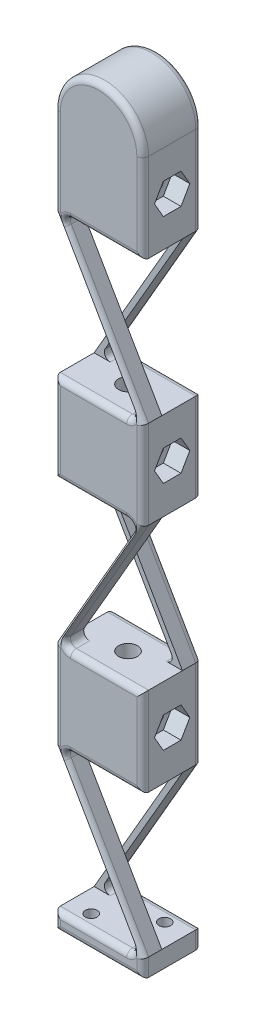
from build123d import *

# Parameters (mm, degrees)
SKETCH1_W                   = 15
SKETCH1_H                   = 15
BOSS_EXTRUDE1_DEPTH         = 5
BOSS_EXTRUDE2_START         = 5
BOSS_EXTRUDE2_DEPTH         = 3.25
BOSS_EXTRUDE3_START         = -5
BOSS_EXTRUDE3_DEPTH         = 3.25
SKETCH1_5_W                 = 15
SKETCH1_5_H                 = 15
BOSS_EXTRUDE4_DEPTH         = 5
BOSS_EXTRUDE5_DEPTH         = 10
SKETCH36_W                  = 15
SKETCH36_H                  = 10
CUT_EXTRUDE1_DEPTH          = 129.56251734
FILLET1_R                   = 1
F_2_0_MM_DOWEL_HOLES1_D     = 2
F_2_0_MM_DOWEL_HOLES1_DEPTH = 3
SKETCH50_R                  = 1.6
CUT_EXTRUDE2_DEPTH          = 15
SKETCH51_R                  = 1.6
CUT_EXTRUDE3_DEPTH          = 15
CUT_SWEEP1_PROFILE_R        = 1.6
CUT_SWEEP3_PROFILE_R        = 1.6
CUT_EXTRUDE4_DEPTH          = 3
LPATTERN1_COUNT             = 3
LPATTERN1_PITCH             = 39.25
LPATTERN2_OUTLINE_R         = 1.6
LPATTERN2_ANGLE             = 90
LPATTERN2_START             = 3.1999999
LPATTERN2_2_OUTLINE_R       = 1.6
LPATTERN2_2_DEPTH           = 1.8000001
FILLET2_R                   = 1


with BuildPart() as part:
    # Sketch1 → Boss-Extrude1 (new, symmetric)
    with BuildSketch(Plane.XY):
        with Locations((0, -19.624355653)):
            Rectangle(SKETCH1_W, SKETCH1_H)
    boss_extrude1 = extrude(amount=BOSS_EXTRUDE1_DEPTH, both=True)

    # Sketch1<3> → Boss-Extrude2 (add)
    with BuildSketch(Plane.XY.offset(BOSS_EXTRUDE2_START)):
        Polygon((-6.5, -12.124355653), (0, -0.866025404), (-0.5, 0), (-7.5, -12.124355653), align=None)
        Polygon((0.5, 0), (7.5, 12.124355653), (6.5, 12.124355653), (0, 0.866025404), align=None)
        Polygon((0, -0.866025404), (0.5, 0), (0, 0.866025404), (-0.5, 0), align=None)
    boss_extrude2 = extrude(amount=-BOSS_EXTRUDE2_DEPTH)

    # Sketch1<4> → Boss-Extrude3 (add)
    with BuildSketch(Plane.XY.offset(BOSS_EXTRUDE3_START)):
        Polygon((0, 0.866025404), (-6.5, 12.124355653), (-7.5, 12.124355653), (-0.5, 0), align=None)
        Polygon((7.5, -12.124355653), (0.5, 0), (0, -0.866025404), (6.5, -12.124355653), align=None)
        Polygon((0, -0.866025404), (0.5, 0), (0, 0.866025404), (-0.5, 0), align=None)
    boss_extrude3 = extrude(amount=BOSS_EXTRUDE3_DEPTH)

    # Sketch1<5> → Boss-Extrude4 (add, symmetric)
    with BuildSketch(Plane.XY):
        with Locations((0, 19.624355653)):
            Rectangle(SKETCH1_5_W, SKETCH1_5_H)
    boss_extrude4 = extrude(amount=BOSS_EXTRUDE4_DEPTH, both=True)

    # Mirror2: Boss-Extrude2, Boss-Extrude3 across plane
    add(boss_extrude2.mirror(Plane(origin=(0, 19.624355653, 0), x_dir=(0, 0, 1), z_dir=(0, -1, 0))))
    add(boss_extrude3.mirror(Plane(origin=(0, 19.624355653, 0), x_dir=(0, 0, 1), z_dir=(0, -1, 0))))

    # Mirror3: Boss-Extrude1 across plane
    add(boss_extrude1.mirror(Plane(origin=(0, 19.624355653, 0), x_dir=(0, 0, 1), z_dir=(0, -1, 0))))

    # Mirror4: Boss-Extrude2 across plane
    add(boss_extrude2.mirror(Plane.ZX.offset(-19.624355653)))

    # Mirror5: Boss-Extrude3 across plane
    add(boss_extrude3.mirror(Plane.ZX.offset(-19.624355653)))

    # Mirror6: Boss-Extrude4 across plane
    add(boss_extrude4.mirror(Plane.ZX.offset(-19.624355653)))

    # Sketch29 → Boss-Extrude5 (add)
    with BuildSketch(Plane.XY.offset(5)):
        with BuildLine():
            ThreePointArc((-7.5, 66.373066959), (0, 73.873066959), (7.5, 66.373066959))
            Line((7.5, 66.373066959), (-7.5, 66.373066959))
        make_face()
    extrude(amount=-BOSS_EXTRUDE5_DEPTH)

    # Sketch36 → Cut-Extrude1 (cut, through all)
    with BuildSketch(Plane(origin=(0, -54.373066959, 0), x_dir=(1, 0, 0), z_dir=(0, 1, 0))):
        Rectangle(SKETCH36_W, SKETCH36_H)
    extrude(amount=-CUT_EXTRUDE1_DEPTH, mode=Mode.SUBTRACT)

    # Fillet1
    fillet1_edges = [part.edges().sort_by_distance(p)[0] for p in [
        (-6.5, -27.124355653, 3.375),
        (6.5, -51.373066959, 3.375),
        (6.5, -27.124355653, -3.375),
        (-6.5, -51.373066959, -3.375),
        (6.5, 12.124355653, 3.375),
        (-6.5, -12.124355653, 3.375),
        (6.5, -12.124355653, -3.375),
        (-6.5, 12.124355653, -3.375),
        (-6.5, 51.373066959, 3.375),
        (6.5, 27.124355653, 3.375),
        (6.5, 51.373066959, -3.375),
        (-6.5, 27.124355653, -3.375),
    ]]
    fillet(fillet1_edges, radius=FILLET1_R)

    # Ø2.0 mm Dowel Holes1
    with Locations(Plane(origin=(0, -51.373066959, 0), x_dir=(1, 0, 0), z_dir=(0, 1, 0))):
        with Locations((3.75, 2.5), (-3.75, -2.5)):
            Hole(F_2_0_MM_DOWEL_HOLES1_D / 2, depth=F_2_0_MM_DOWEL_HOLES1_DEPTH)

    # Sketch50 → Cut-Extrude2 (cut)
    with BuildSketch(Plane(origin=(0, 27.124355653, 0), x_dir=(1, 0, 0), z_dir=(0, 1, 0))):
        with Locations(Location((0, 0, 0), (0, 0, 180))):
            Circle(SKETCH50_R)
    extrude(amount=-CUT_EXTRUDE2_DEPTH, mode=Mode.SUBTRACT)

    # Sketch51 → Cut-Extrude3 (cut)
    with BuildSketch(Plane(origin=(0, -12.124355653, 0), x_dir=(1, 0, 0), z_dir=(0, 1, 0))):
        with Locations(Location((0, 0, 0), (0, 0, 180))):
            Circle(SKETCH51_R)
    extrude(amount=-CUT_EXTRUDE3_DEPTH, mode=Mode.SUBTRACT)

    # Cut-Sweep1: sweep along a path in Sketch10
    with BuildLine(Plane.XY) as cut_sweep1_path:
        Line((0, 12.124355653), (0, 16.424355653))
        ThreePointArc((0, 16.424355653), (0.9372583, 18.687097353), (3.2, 19.624355653))
        Line((3.2, 19.624355653), (7.5, 19.624355653))
    # Cut-Sweep1 profile (on start of the path) → Cut-Sweep1 (sweep, cut)
    with BuildSketch(Plane(origin=(0, 12.124355653, 0), x_dir=(1, 0, 0), z_dir=(0, 1, 0))):
        Circle(CUT_SWEEP1_PROFILE_R)
    sweep(path=cut_sweep1_path.line, mode=Mode.SUBTRACT)

    # Cut-Sweep3: sweep along a path in Sketch67
    with BuildLine(Plane.XY) as cut_sweep3_path:
        Line((0, 51.373066959), (0, 55.673066959))
        ThreePointArc((0, 55.673066959), (0.9372583, 57.935808659), (3.2, 58.873066959))
        Line((3.2, 58.873066959), (7.5, 58.873066959))
    # Cut-Sweep3 profile (on start of the path) → Cut-Sweep3 (sweep, cut)
    with BuildSketch(Plane(origin=(0, 51.373066959, 0), x_dir=(1, 0, 0), z_dir=(0, 1, 0))):
        Circle(CUT_SWEEP3_PROFILE_R)
    sweep(path=cut_sweep3_path.line, mode=Mode.SUBTRACT)

    # Sketch79 → Cut-Extrude4 (cut)
    with BuildSketch(Plane(origin=(7.5, 0, 0), x_dir=(0, 0, -1), z_dir=(1, 0, 0))):
        Polygon((-1.5, 61.47114317), (-3, 58.873066959), (-1.5, 56.274990748), (1.5, 56.274990748), (3, 58.873066959), (1.5, 61.47114317), align=None)
    cut_extrude4 = extrude(amount=-CUT_EXTRUDE4_DEPTH, mode=Mode.SUBTRACT)

    # LPattern1: Cut-Extrude4 ×3
    with Locations(*[(0, -i * LPATTERN1_PITCH, 0) for i in range(1, LPATTERN1_COUNT)]):
        add(cut_extrude4, mode=Mode.SUBTRACT)

    # LPattern2: read off the stored shape, not the designer's step
    # LPattern2 outline → LPattern2 (revolve, cut)
    with BuildSketch(Plane(origin=(3.2, -22.826933041, 0), x_dir=(0, 1, 0), z_dir=(1, 0, 0))):
        with Locations((3.2, 0)):
            Circle(LPATTERN2_OUTLINE_R)
    revolve(axis=Axis((3.2, -22.826933041, 0), (0, 0, 1)), revolution_arc=LPATTERN2_ANGLE, mode=Mode.SUBTRACT)

    # LPattern2 2 outline → LPattern2 2 (cut)
    with BuildSketch(Plane.YZ.offset(LPATTERN2_START)):
        with Locations((-19.626933041, 0)):
            Circle(LPATTERN2_2_OUTLINE_R)
    extrude(amount=LPATTERN2_2_DEPTH, mode=Mode.SUBTRACT)

    # Fillet2
    # the kernel refuses this fillet: 1 mm, written as the material it takes off along each edge
    with BuildSketch(Plane(origin=(10, -27.124355653, 5), x_dir=(0, 0, -1), z_dir=(-1, 0, 0)), Plane(origin=(4.767949192, -51.373066959, 5), x_dir=(0, -1, 0), z_dir=(-1, 0, 0)), Plane(origin=(-10, -12.124355653, -5), x_dir=(0, -1, 0), z_dir=(1, 0, 0)), Plane(origin=(-4.767949192, 27.124355653, -5), x_dir=(0, -1, 0), z_dir=(1, 0, 0)), Plane(origin=(10, 12.124355653, -5), x_dir=(0, 1, 0), z_dir=(-1, 0, 0)), Plane(origin=(-4.767949192, 51.373066959, 5), x_dir=(0, 1, 0), z_dir=(1, 0, 0))) as fillet2_piece_1:
        with BuildLine():
            CenterArc((FILLET2_R, -FILLET2_R), FILLET2_R, 90, 90)
            Line((0, -FILLET2_R), (0, 0))
            Line((0, 0), (FILLET2_R, 0))
        make_face()
    extrude(amount=14.767949192, mode=Mode.SUBTRACT)
    with BuildSketch(Plane(origin=(8.75, -24.959292144, -5), x_dir=(-0.866025403784435, 0.5000000000000062, 0), z_dir=(-0.5000000000000062, -0.8660254037844352, 0)), Plane(origin=(-8.75, -24.959292144, 5), x_dir=(0.8660254037844369, 0.500000000000003, 0), z_dir=(0.5000000000000031, -0.8660254037844369, 0)), Plane(origin=(-5.633974596, -10.624355653, 5), x_dir=(-0.8660254037844368, 0.5000000000000032, 0), z_dir=(0.5000000000000032, 0.8660254037844368, 0)), Plane(origin=(-8.75, 53.538130468, 5), x_dir=(0.8660254037844345, 0.5000000000000073, 0), z_dir=(0.5000000000000073, -0.8660254037844345, 0)), Plane(origin=(5.633974596, -10.624355653, -5), x_dir=(0.8660254037844363, 0.5000000000000042, 0), z_dir=(-0.5000000000000042, 0.8660254037844363, 0)), Plane(origin=(8.75, 53.538130468, -5), x_dir=(-0.8660254037844376, 0.500000000000002, 0), z_dir=(-0.500000000000002, -0.8660254037844376, 0))) as fillet2_piece_2:
        with BuildLine():
            CenterArc((FILLET2_R, -FILLET2_R), FILLET2_R, 90, 90)
            Line((0, -FILLET2_R), (0, 0))
            Line((0, 0), (FILLET2_R, 0))
        make_face()
    extrude(amount=28.767949192, mode=Mode.SUBTRACT)
    with BuildSketch(Plane(origin=(5.633974596, -28.624355653, -5), x_dir=(0.8660254037844349, -0.5000000000000063, 0), z_dir=(-0.5000000000000063, -0.866025403784435, 0)), Plane(origin=(-5.633974596, -28.624355653, 5), x_dir=(-0.866025403784438, -0.5000000000000011, 0), z_dir=(0.5000000000000011, -0.866025403784438, 0)), Plane(origin=(-8.75, -14.289419162, 5), x_dir=(0.8660254037844357, -0.5000000000000052, 0), z_dir=(0.5000000000000052, 0.8660254037844357, 0)), Plane(origin=(-5.633974596, 49.873066959, 5), x_dir=(-0.8660254037844357, -0.5000000000000053, 0), z_dir=(0.5000000000000053, -0.8660254037844356, 0)), Plane(origin=(8.75, -14.289419162, -5), x_dir=(-0.8660254037844363, -0.5000000000000041, 0), z_dir=(-0.5000000000000041, 0.8660254037844364, 0)), Plane(origin=(5.633974596, 49.873066959, -5), x_dir=(0.8660254037844375, -0.5000000000000021, 0), z_dir=(-0.5000000000000021, -0.8660254037844375, 0))) as fillet2_piece_3:
        with BuildLine():
            CenterArc((FILLET2_R, FILLET2_R), FILLET2_R, 180, 90)
            Line((0, FILLET2_R), (0, 0))
            Line((0, 0), (FILLET2_R, 0))
        make_face()
    extrude(amount=28.767949192, mode=Mode.SUBTRACT)
    with BuildSketch(Plane(origin=(10, -51.373066959, -5), x_dir=(0, -1, 0), z_dir=(-1, 0, 0)), Plane(origin=(4.767949192, -27.124355653, -5), x_dir=(0, 0, 1), z_dir=(-1, 0, 0)), Plane(origin=(4.767949192, 12.124355653, 5), x_dir=(0, 1, 0), z_dir=(-1, 0, 0)), Plane(origin=(-10, 51.373066959, -5), x_dir=(0, 1, 0), z_dir=(1, 0, 0)), Plane(origin=(-10, 27.124355653, 5), x_dir=(0, -1, 0), z_dir=(1, 0, 0)), Plane(origin=(-4.767949192, -12.124355653, 5), x_dir=(0, -1, 0), z_dir=(1, 0, 0))) as fillet2_piece_4:
        with BuildLine():
            CenterArc((FILLET2_R, FILLET2_R), FILLET2_R, 180, 90)
            Line((0, FILLET2_R), (0, 0))
            Line((0, 0), (FILLET2_R, 0))
        make_face()
    extrude(amount=14.767949192, mode=Mode.SUBTRACT)
    with BuildSketch(Plane(origin=(0, 66.373066959, -5), x_dir=(-1, 0, 0), z_dir=(0, -1, 0))) as fillet2_piece_5:
        with BuildLine():
            CenterArc((7.5 - FILLET2_R, -FILLET2_R), FILLET2_R, 0, 90)
            Line((7.5, -FILLET2_R), (7.5, 0))
            Line((7.5, 0), (7.5 - FILLET2_R, 0))
        make_face()
    revolve(axis=Axis((0, 66.373066959, -5), (0, 0, -1)), revolution_arc=180, mode=Mode.SUBTRACT)
    with BuildSketch(Plane(origin=(0, 66.373066959, 5), x_dir=(-1, 0, 0), z_dir=(0, -1, 0))) as fillet2_piece_6:
        with BuildLine():
            CenterArc((7.5 - FILLET2_R, FILLET2_R), FILLET2_R, 270, 90)
            Line((7.5, FILLET2_R), (7.5, 0))
            Line((7.5, 0), (7.5 - FILLET2_R, 0))
        make_face()
    revolve(axis=Axis((0, 66.373066959, 5), (0, 0, -1)), revolution_arc=180, mode=Mode.SUBTRACT)
    with BuildSketch(Plane(origin=(-7.5, -48.873066959, -5), x_dir=(1, 0, 0), z_dir=(0, -1, 0)), Plane(origin=(7.5, -56.873066959, -5), x_dir=(-1, 0, 0), z_dir=(0, 1, 0))) as fillet2_piece_7:
        with BuildLine():
            CenterArc((FILLET2_R, FILLET2_R), FILLET2_R, 180, 90)
            Line((0, FILLET2_R), (0, 0))
            Line((0, 0), (FILLET2_R, 0))
        make_face()
    extrude(amount=8, mode=Mode.SUBTRACT)
    with BuildSketch(Plane(origin=(-7.5, -48.873066959, 5), x_dir=(1, 0, 0), z_dir=(0, -1, 0)), Plane(origin=(7.5, -56.873066959, 5), x_dir=(-1, 0, 0), z_dir=(0, 1, 0))) as fillet2_piece_8:
        with BuildLine():
            CenterArc((FILLET2_R, -FILLET2_R), FILLET2_R, 90, 90)
            Line((0, -FILLET2_R), (0, 0))
            Line((0, 0), (FILLET2_R, 0))
        make_face()
    extrude(amount=8, mode=Mode.SUBTRACT)
    with BuildSketch(Plane(origin=(7.5, -9.624355653, 5), x_dir=(-1, 0, 0), z_dir=(0, -1, 0)), Plane(origin=(7.5, 29.624355653, 5), x_dir=(-1, 0, 0), z_dir=(0, -1, 0)), Plane(origin=(-7.5, 9.624355653, 5), x_dir=(1, 0, 0), z_dir=(0, 1, 0)), Plane(origin=(-7.5, -29.624355653, 5), x_dir=(1, 0, 0), z_dir=(0, 1, 0)), Plane(origin=(7.5, -9.624355653, -5), x_dir=(0, 0, 1), z_dir=(0, -1, 0)), Plane(origin=(-7.5, -29.624355653, -5), x_dir=(0, 0, 1), z_dir=(0, 1, 0))) as fillet2_piece_9:
        with BuildLine():
            CenterArc((FILLET2_R, FILLET2_R), FILLET2_R, 180, 90)
            Line((0, FILLET2_R), (0, 0))
            Line((0, 0), (FILLET2_R, 0))
        make_face()
    extrude(amount=20, mode=Mode.SUBTRACT)
    with BuildSketch(Plane(origin=(-10, -54.373066959, 5), x_dir=(0, 1, 0), z_dir=(1, 0, 0)), Plane(origin=(10, -54.373066959, -5), x_dir=(0, 1, 0), z_dir=(-1, 0, 0)), Plane(origin=(-7.5, 9.624355653, -5), x_dir=(1, 0, 0), z_dir=(0, 1, 0)), Plane(origin=(7.5, 29.624355653, -5), x_dir=(-1, 0, 0), z_dir=(0, -1, 0))) as fillet2_piece_10:
        with BuildLine():
            CenterArc((FILLET2_R, -FILLET2_R), FILLET2_R, 90, 90)
            Line((0, -FILLET2_R), (0, 0))
            Line((0, 0), (FILLET2_R, 0))
        make_face()
    extrude(amount=20, mode=Mode.SUBTRACT)
    with BuildSketch(Plane(origin=(-4.767949192, -50.373066959, -5), x_dir=(0, -1, 0), z_dir=(1, 0, 0))) as fillet2_piece_11:
        with BuildLine():
            CenterArc((1 + FILLET2_R, -FILLET2_R), FILLET2_R, 90, 90)
            Line((1, -FILLET2_R), (1, 0))
            Line((1, 0), (1 + FILLET2_R, 0))
        make_face()
    revolve(axis=Axis((-4.767949192, -50.373066959, -5), (0, 0, -1)), revolution_arc=120, mode=Mode.SUBTRACT)
    with BuildSketch(Plane(origin=(4.767949192, -50.373066959, 5), x_dir=(0.8660254037844349, 0.5000000000000067, 0), z_dir=(-0.5000000000000067, 0.8660254037844349, 0))) as fillet2_piece_12:
        with BuildLine():
            CenterArc((1 + FILLET2_R, FILLET2_R), FILLET2_R, 180, 90)
            Line((1, FILLET2_R), (1, 0))
            Line((1, 0), (1 + FILLET2_R, 0))
        make_face()
    revolve(axis=Axis((4.767949192, -50.373066959, 5), (0, 0, -1)), revolution_arc=120, mode=Mode.SUBTRACT)
    with BuildSketch(Plane(origin=(4.767949192, -28.124355653, -5), x_dir=(0, 1, 0), z_dir=(-1, 0, 0))) as fillet2_piece_13:
        with BuildLine():
            CenterArc((1 + FILLET2_R, -FILLET2_R), FILLET2_R, 90, 90)
            Line((1 + FILLET2_R, 0), (1, 0))
            Line((1, 0), (1, -FILLET2_R))
        make_face()
    revolve(axis=Axis((4.767949192, -28.124355653, -5), (0, 0, -1)), revolution_arc=120, mode=Mode.SUBTRACT)
    with BuildSketch(Plane(origin=(-4.767949192, -28.124355653, 5), x_dir=(0, 1, 0), z_dir=(1, 0, 0))) as fillet2_piece_14:
        with BuildLine():
            CenterArc((1 + FILLET2_R, -FILLET2_R), FILLET2_R, 90, 90)
            Line((1, -FILLET2_R), (1, 0))
            Line((1, 0), (1 + FILLET2_R, 0))
        make_face()
    revolve(axis=Axis((-4.767949192, -28.124355653, 5), (0, 0, 1)), revolution_arc=120, mode=Mode.SUBTRACT)
    with BuildSketch(Plane(origin=(-4.767949192, -11.124355653, 5), x_dir=(0, -1, 0), z_dir=(1, 0, 0))) as fillet2_piece_15:
        with BuildLine():
            CenterArc((1 + FILLET2_R, FILLET2_R), FILLET2_R, 180, 90)
            Line((1, FILLET2_R), (1, 0))
            Line((1, 0), (1 + FILLET2_R, 0))
        make_face()
    revolve(axis=Axis((-4.767949192, -11.124355653, 5), (0, 0, -1)), revolution_arc=120, mode=Mode.SUBTRACT)
    with BuildSketch(Plane(origin=(4.767949192, -11.124355653, -5), x_dir=(0, -1, 0), z_dir=(-1, 0, 0))) as fillet2_piece_16:
        with BuildLine():
            CenterArc((1 + FILLET2_R, FILLET2_R), FILLET2_R, 180, 90)
            Line((1, FILLET2_R), (1, 0))
            Line((1, 0), (1 + FILLET2_R, 0))
        make_face()
    revolve(axis=Axis((4.767949192, -11.124355653, -5), (0, 0, 1)), revolution_arc=120, mode=Mode.SUBTRACT)
    with BuildSketch(Plane(origin=(-4.767949192, 11.124355653, -5), x_dir=(-0.8660254037844357, -0.5000000000000053, 0), z_dir=(0.5000000000000053, -0.8660254037844357, 0))) as fillet2_piece_17:
        with BuildLine():
            CenterArc((1 + FILLET2_R, -FILLET2_R), FILLET2_R, 90, 90)
            Line((1, -FILLET2_R), (1, 0))
            Line((1, 0), (1 + FILLET2_R, 0))
        make_face()
    revolve(axis=Axis((-4.767949192, 11.124355653, -5), (0, 0, -1)), revolution_arc=120, mode=Mode.SUBTRACT)
    with BuildSketch(Plane(origin=(4.767949192, 11.124355653, 5), x_dir=(0.8660254037844344, -0.5000000000000074, 0), z_dir=(-0.5000000000000074, -0.8660254037844344, 0))) as fillet2_piece_18:
        with BuildLine():
            CenterArc((1 + FILLET2_R, -FILLET2_R), FILLET2_R, 90, 90)
            Line((1, -FILLET2_R), (1, 0))
            Line((1, 0), (1 + FILLET2_R, 0))
        make_face()
    revolve(axis=Axis((4.767949192, 11.124355653, 5), (0, 0, 1)), revolution_arc=120, mode=Mode.SUBTRACT)
    with BuildSketch(Plane(origin=(4.767949192, 50.373066959, -5), x_dir=(0, 1, 0), z_dir=(-1, 0, 0))) as fillet2_piece_19:
        with BuildLine():
            CenterArc((1 + FILLET2_R, -FILLET2_R), FILLET2_R, 90, 90)
            Line((1, -FILLET2_R), (1, 0))
            Line((1, 0), (1 + FILLET2_R, 0))
        make_face()
    revolve(axis=Axis((4.767949192, 50.373066959, -5), (0, 0, -1)), revolution_arc=120, mode=Mode.SUBTRACT)
    with BuildSketch(Plane(origin=(-4.767949192, 50.373066959, 5), x_dir=(0, 1, 0), z_dir=(1, 0, 0))) as fillet2_piece_20:
        with BuildLine():
            CenterArc((1 + FILLET2_R, -FILLET2_R), FILLET2_R, 90, 90)
            Line((1, -FILLET2_R), (1, 0))
            Line((1, 0), (1 + FILLET2_R, 0))
        make_face()
    revolve(axis=Axis((-4.767949192, 50.373066959, 5), (0, 0, 1)), revolution_arc=120, mode=Mode.SUBTRACT)
    with BuildSketch(Plane(origin=(4.767949192, 28.124355653, 5), x_dir=(0, -1, 0), z_dir=(-1, 0, 0))) as fillet2_piece_21:
        with BuildLine():
            CenterArc((1 + FILLET2_R, -FILLET2_R), FILLET2_R, 90, 90)
            Line((1, -FILLET2_R), (1, 0))
            Line((1, 0), (1 + FILLET2_R, 0))
        make_face()
    revolve(axis=Axis((4.767949192, 28.124355653, 5), (0, 0, 1)), revolution_arc=120, mode=Mode.SUBTRACT)
    with BuildSketch(Plane(origin=(-4.767949192, 28.124355653, -5), x_dir=(0, -1, 0), z_dir=(1, 0, 0))) as fillet2_piece_22:
        with BuildLine():
            CenterArc((1 + FILLET2_R, -FILLET2_R), FILLET2_R, 90, 90)
            Line((1, -FILLET2_R), (1, 0))
            Line((1, 0), (1 + FILLET2_R, 0))
        make_face()
    revolve(axis=Axis((-4.767949192, 28.124355653, -5), (0, 0, -1)), revolution_arc=120, mode=Mode.SUBTRACT)
    with BuildSketch(Plane(origin=(-7.5, 66.373066959, -5), x_dir=(1, 0, 0), z_dir=(0, -1, 0)), Plane(origin=(7.5, 48.873066959, -5), x_dir=(-1, 0, 0), z_dir=(0, 1, 0))) as fillet2_piece_23:
        with BuildLine():
            CenterArc((FILLET2_R, FILLET2_R), FILLET2_R, 180, 90)
            Line((0, FILLET2_R), (0, 0))
            Line((0, 0), (FILLET2_R, 0))
        make_face()
    extrude(amount=17.5, mode=Mode.SUBTRACT)
    with BuildSketch(Plane(origin=(7.5, 48.873066959, 5), x_dir=(-1, 0, 0), z_dir=(0, 1, 0)), Plane(origin=(-7.5, 66.373066959, 5), x_dir=(1, 0, 0), z_dir=(0, -1, 0))) as fillet2_piece_24:
        with BuildLine():
            CenterArc((FILLET2_R, -FILLET2_R), FILLET2_R, 90, 90)
            Line((0, -FILLET2_R), (0, 0))
            Line((0, 0), (FILLET2_R, 0))
        make_face()
    extrude(amount=17.5, mode=Mode.SUBTRACT)


solid = part.part
